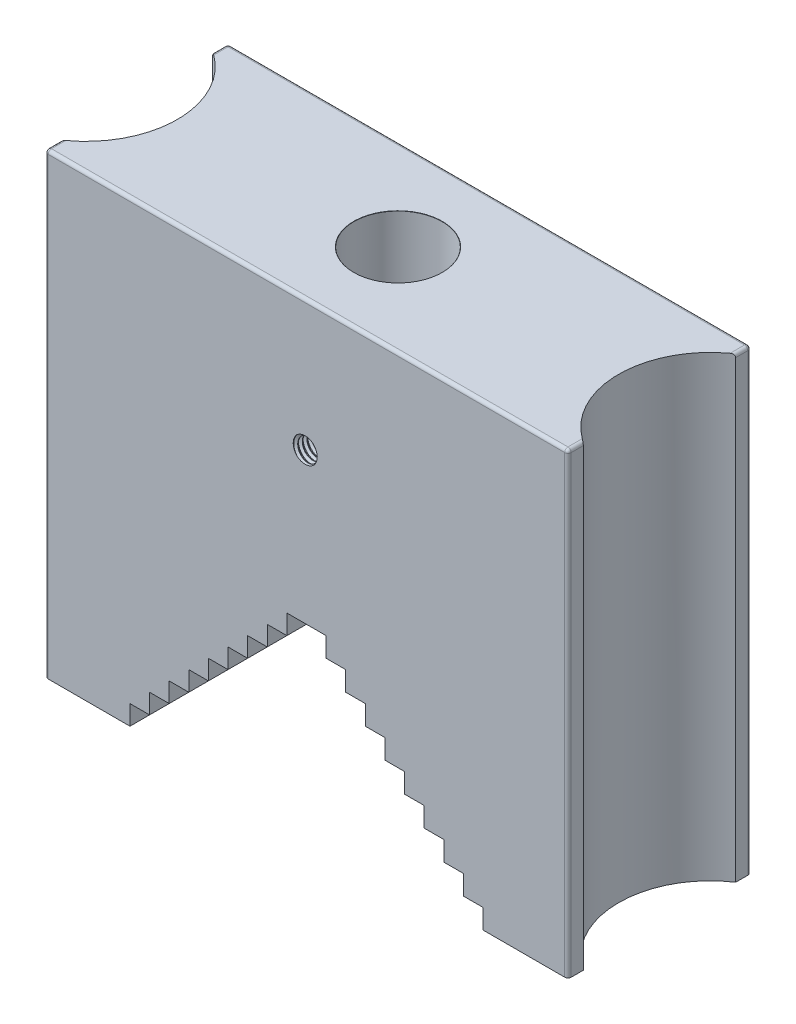
from build123d import *

# Parameters (mm, degrees)
BOSS_EXTRUDE1_DEPTH                    = 14
MIRROR1_START                          = 27
MIRROR1_OUTLINE_W                      = 40
MIRROR1_OUTLINE_H                      = 28
MIRROR1_DEPTH                          = 43
MIRROR1_START_2                        = 6
MIRROR1_2_OUTLINE_W                    = 19
MIRROR1_2_OUTLINE_H                    = 28
MIRROR1_2_DEPTH                        = 21
MIRROR1_START_3                        = 15
MIRROR1_3_OUTLINE_W                    = 9
MIRROR1_3_OUTLINE_H                    = 28
MIRROR1_3_DEPTH                        = 12
MIRROR1_4_OUTLINE_W                    = 13
MIRROR1_4_OUTLINE_H                    = 28
MIRROR1_4_DEPTH                        = 6
MIRROR1_START_4                        = 21
MIRROR1_5_OUTLINE_W                    = 6
MIRROR1_5_OUTLINE_H                    = 28
MIRROR1_5_DEPTH                        = 6
MIRROR1_START_5                        = 9
MIRROR1_6_OUTLINE_W                    = 3
MIRROR1_6_OUTLINE_H                    = 28
MIRROR1_6_DEPTH                        = 6
MIRROR1_START_6                        = 3
MIRROR1_7_OUTLINE_W                    = 3
MIRROR1_7_OUTLINE_H                    = 28
MIRROR1_7_DEPTH                        = 3
MIRROR1_START_7                        = 12
MIRROR1_8_OUTLINE_W                    = 3
MIRROR1_8_OUTLINE_H                    = 28
MIRROR1_8_DEPTH                        = 3
MIRROR1_START_8                        = 18
MIRROR1_9_OUTLINE_W                    = 3
MIRROR1_9_OUTLINE_H                    = 28
MIRROR1_9_DEPTH                        = 3
MIRROR1_START_9                        = 24
MIRROR1_10_OUTLINE_W                   = 3
MIRROR1_10_OUTLINE_H                   = 28
MIRROR1_10_DEPTH                       = 3
FILLET1_R                              = 0.5
F_13_5_13_5_DIAMETER_HOLE1_D           = 13.5
F_13_5_13_5_DIAMETER_HOLE1_DEPTH       = 28
F_13_5_13_5_DIAMETER_HOLE1_CSINK_D     = 13.55
F_13_5_13_5_DIAMETER_HOLE1_CSINK_ANGLE = 90
F_13_5_13_5_DIAMETER_HOLE1_TIP         = 6.75
TAP_DRILL_FOR_M4_TAP1_D                = 3.3
TAP_DRILL_FOR_M4_TAP1_CSINK_D          = 3.35
TAP_DRILL_FOR_M4_TAP1_CSINK_ANGLE      = 90
THREAD5_PITCH                          = 0.7
F_25_5_28_DIAMETER_HOLE1_D             = 28


# Read off the part's stored shape, not the designer's step: Mirror1
with BuildPart() as part:
    # Sketch1 → Boss-Extrude1 (new, symmetric)
    with BuildSketch(Plane.XY):
        Polygon((-3, 24), (-3, 27), (0, 27), (0, 70), (-40, 70), (-40, 0), (-27, 0), (-27, 3), (-24, 3), (-24, 6), (-21, 6), (-21, 9), (-18, 9), (-18, 12), (-15, 12), (-15, 15), (-12, 15), (-12, 18), (-9, 18), (-9, 21), (-6, 21), (-6, 24), align=None)
    extrude(amount=BOSS_EXTRUDE1_DEPTH, both=True)

    # Mirror1 outline → Mirror1 (add)
    with BuildSketch(Plane(origin=(0, 0, 0), x_dir=(1, 0, 0), z_dir=(0, 1, 0)).offset(MIRROR1_START)):
        with Locations((20, 0)):
            Rectangle(MIRROR1_OUTLINE_W, MIRROR1_OUTLINE_H)
    extrude(amount=MIRROR1_DEPTH)

    # Mirror1 2 outline → Mirror1 2 (add)
    with BuildSketch(Plane(origin=(0, 0, 0), x_dir=(1, 0, 0), z_dir=(0, 1, 0)).offset(MIRROR1_START_2)):
        with Locations((30.5, 0)):
            Rectangle(MIRROR1_2_OUTLINE_W, MIRROR1_2_OUTLINE_H)
    extrude(amount=MIRROR1_2_DEPTH)

    # Mirror1 3 outline → Mirror1 3 (add)
    with BuildSketch(Plane(origin=(0, 0, 0), x_dir=(1, 0, 0), z_dir=(0, 1, 0)).offset(MIRROR1_START_3)):
        with Locations((16.5, 0)):
            Rectangle(MIRROR1_3_OUTLINE_W, MIRROR1_3_OUTLINE_H)
    extrude(amount=MIRROR1_3_DEPTH)

    # Mirror1 4 outline → Mirror1 4 (add)
    with BuildSketch(Plane(origin=(0, 0, 0), x_dir=(1, 0, 0), z_dir=(0, 1, 0))):
        with Locations((33.5, 0)):
            Rectangle(MIRROR1_4_OUTLINE_W, MIRROR1_4_OUTLINE_H)
    extrude(amount=MIRROR1_4_DEPTH)

    # Mirror1 5 outline → Mirror1 5 (add)
    with BuildSketch(Plane(origin=(0, 0, 0), x_dir=(1, 0, 0), z_dir=(0, 1, 0)).offset(MIRROR1_START_4)):
        with Locations((9, 0)):
            Rectangle(MIRROR1_5_OUTLINE_W, MIRROR1_5_OUTLINE_H)
    extrude(amount=MIRROR1_5_DEPTH)

    # Mirror1 6 outline → Mirror1 6 (add)
    with BuildSketch(Plane(origin=(0, 0, 0), x_dir=(1, 0, 0), z_dir=(0, 1, 0)).offset(MIRROR1_START_5)):
        with Locations((19.5, 0)):
            Rectangle(MIRROR1_6_OUTLINE_W, MIRROR1_6_OUTLINE_H)
    extrude(amount=MIRROR1_6_DEPTH)

    # Mirror1 7 outline → Mirror1 7 (add)
    with BuildSketch(Plane(origin=(0, 0, 0), x_dir=(1, 0, 0), z_dir=(0, 1, 0)).offset(MIRROR1_START_6)):
        with Locations((25.5, 0)):
            Rectangle(MIRROR1_7_OUTLINE_W, MIRROR1_7_OUTLINE_H)
    extrude(amount=MIRROR1_7_DEPTH)

    # Mirror1 8 outline → Mirror1 8 (add)
    with BuildSketch(Plane(origin=(0, 0, 0), x_dir=(1, 0, 0), z_dir=(0, 1, 0)).offset(MIRROR1_START_7)):
        with Locations((16.5, 0)):
            Rectangle(MIRROR1_8_OUTLINE_W, MIRROR1_8_OUTLINE_H)
    extrude(amount=MIRROR1_8_DEPTH)

    # Mirror1 9 outline → Mirror1 9 (add)
    with BuildSketch(Plane(origin=(0, 0, 0), x_dir=(1, 0, 0), z_dir=(0, 1, 0)).offset(MIRROR1_START_8)):
        with Locations((10.5, 0)):
            Rectangle(MIRROR1_9_OUTLINE_W, MIRROR1_9_OUTLINE_H)
    extrude(amount=MIRROR1_9_DEPTH)

    # Mirror1 10 outline → Mirror1 10 (add)
    with BuildSketch(Plane(origin=(0, 0, 0), x_dir=(1, 0, 0), z_dir=(0, 1, 0)).offset(MIRROR1_START_9)):
        with Locations((4.5, 0)):
            Rectangle(MIRROR1_10_OUTLINE_W, MIRROR1_10_OUTLINE_H)
    extrude(amount=MIRROR1_10_DEPTH)

    # Fillet1
    fillet1_edges = [part.edges().sort_by_distance(p)[0] for p in [
        (0, 70, 14),
        (-40, 35, 14),
        (-40, 35, -14),
        (0, 70, -14),
        (-40, 70, 0),
        (40, 35, -14),
        (40, 70, 0),
        (40, 35, 14),
    ]]
    fillet(fillet1_edges, radius=FILLET1_R)

    # Ø13.5 (13.5) Diameter Hole1
    with Locations(Plane(origin=(0, 70, 0), x_dir=(1, 0, 0), z_dir=(0, 1, 0))):
        with Locations((0, 0)):
            CounterSinkHole(F_13_5_13_5_DIAMETER_HOLE1_D / 2, F_13_5_13_5_DIAMETER_HOLE1_CSINK_D / 2, depth=F_13_5_13_5_DIAMETER_HOLE1_DEPTH, counter_sink_angle=F_13_5_13_5_DIAMETER_HOLE1_CSINK_ANGLE)
            with Locations((0, 0, -(F_13_5_13_5_DIAMETER_HOLE1_DEPTH + F_13_5_13_5_DIAMETER_HOLE1_TIP / 2))):  # 90° drill point
                Cone(0, F_13_5_13_5_DIAMETER_HOLE1_D / 2, F_13_5_13_5_DIAMETER_HOLE1_TIP, mode=Mode.SUBTRACT)

    # Tap Drill for M4 Tap1 (through all)
    with Locations(Plane(origin=(0, 0, -14), x_dir=(-1, 0, 0), z_dir=(0, 0, -1))):
        with Locations((0, 50)):
            CounterSinkHole(TAP_DRILL_FOR_M4_TAP1_D / 2, TAP_DRILL_FOR_M4_TAP1_CSINK_D / 2, counter_sink_angle=TAP_DRILL_FOR_M4_TAP1_CSINK_ANGLE)

    # Thread5: the profile of Thread Profile2 profile screwed along a right-hand helix of 42.857143 turns, 6 arcs to a turn; built about Z, then put on its axis
    thread5_z = Axis((0, 0, 0), (0, 0, 1))
    thread5_corners = [(1.6497, 0, -0.000173205), (1.6497, 0, 0.612673203), (2.028886112, 0, 0.393749999), (2.028886112, 0, 0.218749999)]
    with BuildLine(mode=Mode.PRIVATE) as thread5_profile:
        Line(thread5_corners[0], thread5_corners[1])
        Line(thread5_corners[1], thread5_corners[2])
        Line(thread5_corners[2], thread5_corners[3])
        Line(thread5_corners[3], thread5_corners[0])
    thread5_cap = Face(thread5_profile.wire())
    thread5_turn_angles = [0, 30, 60, 90, 120, 150, 180, 210, 240, 270, 300, 330, 360]
    thread5_turn_weights = [1, 0.8660254037844387, 1, 0.8660254037844387, 1, 0.8660254037844387, 1, 0.8660254037844387, 1, 0.8660254037844387, 1, 0.8660254037844387, 1]
    thread5_turn_rails = [Edge.make_bspline([Vector(p[0], p[1], 0).rotate(thread5_z, thread5_turn_angles[k]) / thread5_turn_weights[k] + Vector(0, 0, p[2] + THREAD5_PITCH * thread5_turn_angles[k] / 360) for k in range(13)], [0, 0, 0, 1, 1, 2, 2, 3, 3, 4, 4, 5, 5, 6, 6, 6], 2, thread5_turn_weights) for p in thread5_corners]
    thread5_turn_sides = [Face.make_surface_from_curves(thread5_turn_rails[p[0]], thread5_turn_rails[p[1]]) for p in [(0, 1), (1, 2), (2, 3), (3, 0)]]
    thread5_turn = Solid(Shell([*thread5_turn_sides, thread5_cap, thread5_cap.rotate(thread5_z, 360).moved(Location((0, 0, THREAD5_PITCH * 360 / 360)))]))
    thread5_last_angles = [15120, 15150, 15180, 15210, 15240, 15270, 15300, 15330, 15360, 15390, 15420, 15424.285714286, 15428.571428571]
    thread5_last_weights = [1, 0.8660254037844387, 1, 0.8660254037844387, 1, 0.8660254037844387, 1, 0.8660254037844387, 1, 0.8660254037844387, 1, 0.9972037971811797, 1]
    thread5_last_rails = [Edge.make_bspline([Vector(p[0], p[1], 0).rotate(thread5_z, thread5_last_angles[k]) / thread5_last_weights[k] + Vector(0, 0, p[2] + THREAD5_PITCH * thread5_last_angles[k] / 360) for k in range(13)], [0, 0, 0, 1, 1, 2, 2, 3, 3, 4, 4, 5, 5, 6, 6, 6], 2, thread5_last_weights) for p in thread5_corners]
    thread5_last_sides = [Face.make_surface_from_curves(thread5_last_rails[p[0]], thread5_last_rails[p[1]]) for p in [(0, 1), (1, 2), (2, 3), (3, 0)]]
    thread5_last = Solid(Shell([*thread5_last_sides, thread5_cap.rotate(thread5_z, 15120).moved(Location((0, 0, THREAD5_PITCH * 15120 / 360))), thread5_cap.rotate(thread5_z, 15428.571428571).moved(Location((0, 0, THREAD5_PITCH * 15428.571428571 / 360)))]))
    thread5_each = [*[thread5_turn.moved(Location((0, 0, THREAD5_PITCH * i))) for i in range(42)], thread5_last]
    add(Plane(origin=(0, 50, 15), x_dir=(-1, 0, 0), z_dir=(0, 0, -1)) * Compound([thread5_each[i] for i in range(0, 43, 2)]), mode=Mode.SUBTRACT)
    add(Plane(origin=(0, 50, 15), x_dir=(-1, 0, 0), z_dir=(0, 0, -1)) * Compound([thread5_each[i] for i in range(1, 43, 2)]), mode=Mode.SUBTRACT)

    # Ø25.5 (28) Diameter Hole1 (through all)
    with Locations(Plane(origin=(0, 70, 0), x_dir=(1, 0, 0), z_dir=(0, 1, 0))):
        with Locations((47.75, 0), (-47.75, 0)):
            Hole(F_25_5_28_DIAMETER_HOLE1_D / 2)


solid = part.part
